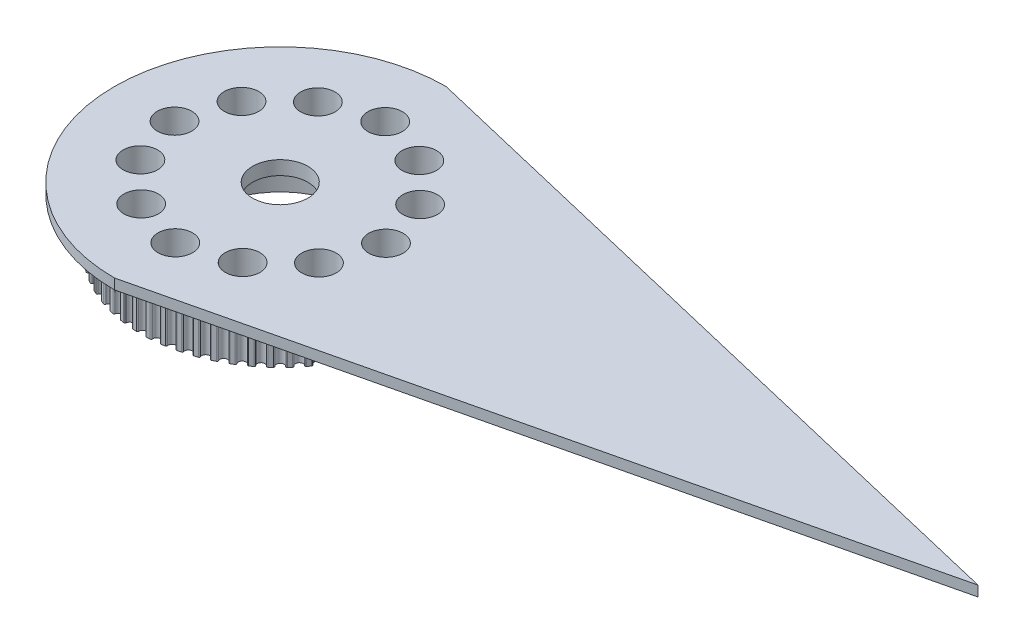
from build123d import *

# Parameters (mm, degrees)
BOSS_EXTRUDE1_DEPTH = 1.5
SKETCH2_R           = 11
BOSS_EXTRUDE3_DEPTH = 7.5
SKETCH3_R           = 6
SKETCH3_R_2         = 4
BOSS_EXTRUDE4_DEPTH = 0.5
SKETCH4_R           = 4
CUT_EXTRUDE1_DEPTH  = 105.082899652
SKETCH5_R           = 2.5
CUT_EXTRUDE2_DEPTH  = 105.201727433


with BuildPart() as part:
    # Sketch1 → Boss-Extrude1 (new body)
    with BuildSketch(Plane(origin=(0, 0, 0), x_dir=(1, 0, 0), z_dir=(0, 1, 0))):
        with BuildLine():
            Line((0, 24), (101, 0))
            Line((101, 0), (0, -24))
            ThreePointArc((0, -24), (-24, 0), (0, 24))
        make_face()
    extrude(amount=BOSS_EXTRUDE1_DEPTH)

    # Sketch2 → Boss-Extrude3 (add)
    with BuildSketch(Plane.XZ):
        with BuildLine():
            ThreePointArc((0, 19.37), (0.40140939, 19.54173051), (0.554407106, 19.950646841))
            ThreePointArc((0.554407106, 19.950646841), (0.597601495, 20.063061902), (0.709536651, 20.107485117))
            ThreePointArc((0.709536651, 20.107485117), (0.987241607, 20.095764579), (1.264758152, 20.080208834))
            ThreePointArc((1.264758152, 20.080208834), (1.371800073, 20.025027964), (1.403767866, 19.908920422))
            ThreePointArc((1.403767866, 19.908920422), (1.515948048, 19.486976737), (1.898592008, 19.276728156))
            ThreePointArc((1.898592008, 19.276728156), (2.314901036, 19.408286736), (2.507242836, 19.800237624))
            ThreePointArc((2.507242836, 19.800237624), (2.561247834, 19.907877585), (2.676998228, 19.941115327))
            ThreePointArc((2.676998228, 19.941115327), (2.952217146, 19.90223138), (3.226872643, 19.859549163))
            ThreePointArc((3.226872643, 19.859549163), (3.327990457, 19.794142061), (3.348423787, 19.675460217))
            ThreePointArc((3.348423787, 19.675460217), (3.418706077, 19.244552725), (3.778899537, 18.997810881))
            ThreePointArc((3.778899537, 18.997810881), (4.206098919, 19.087930551), (4.435932446, 19.459141295))
            ThreePointArc((4.435932446, 19.459141295), (4.500227957, 19.560969525), (4.61867885, 19.582701695))
            ThreePointArc((4.61867885, 19.582701695), (4.88876122, 19.517028814), (5.157910587, 19.447631177))
            ThreePointArc((5.157910587, 19.447631177), (5.252130474, 19.372627749), (5.260832557, 19.252514574))
            ThreePointArc((5.260832557, 19.252514574), (5.288540098, 18.81679315), (5.622814198, 18.535934303))
            ThreePointArc((5.622814198, 18.535934303), (6.05678977, 18.58374716), (6.321901602, 18.930642798))
            ThreePointArc((6.321901602, 18.930642798), (6.395868424, 19.025678635), (6.515879069, 19.035695941))
            ThreePointArc((6.515879069, 19.035695941), (6.77822385, 18.943866591), (7.039275031, 18.848421871))
            ThreePointArc((7.039275031, 18.848421871), (7.125689602, 18.764544442), (7.122576633, 18.644156691))
            ThreePointArc((7.122576633, 18.644156691), (7.107442587, 18.207817571), (7.412578085, 17.895546545))
            ThreePointArc((7.412578085, 17.895546545), (7.849150425, 17.900592125), (8.146987389, 18.219831862))
            ThreePointArc((8.146987389, 18.219831862), (8.229913182, 18.307160059), (8.35032781, 18.305366029))
            ThreePointArc((8.35032781, 18.305366029), (8.60240848, 18.188264578), (8.85284741, 18.067691959))
            ThreePointArc((8.85284741, 18.067691959), (8.930624445, 17.975748314), (8.915726402, 17.856245387))
            ThreePointArc((8.915726402, 17.856245387), (8.857896518, 17.423490756), (9.130954792, 17.08281489))
            ThreePointArc((9.130954792, 17.08281489), (9.565919471, 17.045044603), (9.893613234, 17.333553985))
            ThreePointArc((9.893613234, 17.333553985), (9.984699377, 17.412333524), (10.10435833, 17.398745436))
            ThreePointArc((10.10435833, 17.398745436), (10.343747213, 17.257499633), (10.581162028, 17.112960297))
            ThreePointArc((10.581162028, 17.112960297), (10.649552492, 17.013835903), (10.623012852, 16.896368679))
            ThreePointArc((10.623012852, 16.896368679), (10.523044063, 16.471366199), (10.761395414, 16.10556639))
            ThreePointArc((10.761395414, 16.10556639), (11.190563483, 16.025343983), (11.544958176, 16.280344508))
            ThreePointArc((11.544958176, 16.280344508), (11.643327459, 16.349816699), (11.761078356, 16.324565412))
            ThreePointArc((11.761078356, 16.324565412), (11.985470006, 16.160535533), (12.207574272, 15.993421473))
            ThreePointArc((12.207574272, 15.993421473), (12.265919528, 15.888070952), (12.227993882, 15.773770704))
            ThreePointArc((12.227993882, 15.773770704), (12.086848942, 15.360613382), (12.288197914, 14.973212482))
            ThreePointArc((12.288197914, 14.973212482), (12.707436251, 14.85131054), (13.085118859, 15.070346414))
            ThreePointArc((13.085118859, 15.070346414), (13.189823933, 15.129842201), (13.304532768, 15.0931709))
            ThreePointArc((13.304532768, 15.0931709), (13.511766172, 14.907936642), (13.716420902, 14.719857256))
            ThreePointArc((13.716420902, 14.719857256), (13.764159052, 14.609295192), (13.715212646, 14.499262694))
            ThreePointArc((13.715212646, 14.499262694), (13.534250858, 14.101929462), (13.696658352, 13.696658352))
            ThreePointArc((13.696658352, 13.696658352), (14.101929462, 13.534250858), (14.499262694, 13.715212646))
            ThreePointArc((14.499262694, 13.715212646), (14.609295192, 13.764159052), (14.719857256, 13.716420902))
            ThreePointArc((14.719857256, 13.716420902), (14.907936642, 13.511766172), (15.0931709, 13.304532768))
            ThreePointArc((15.0931709, 13.304532768), (15.129842201, 13.189823933), (15.070346414, 13.085118859))
            ThreePointArc((15.070346414, 13.085118859), (14.85131054, 12.707436251), (14.973212482, 12.288197914))
            ThreePointArc((14.973212482, 12.288197914), (15.360613382, 12.086848942), (15.773770704, 12.227993882))
            ThreePointArc((15.773770704, 12.227993882), (15.888070952, 12.265919528), (15.993421473, 12.207574272))
            ThreePointArc((15.993421473, 12.207574272), (16.160535533, 11.985470006), (16.324565412, 11.761078356))
            ThreePointArc((16.324565412, 11.761078356), (16.349816699, 11.643327459), (16.280344508, 11.544958176))
            ThreePointArc((16.280344508, 11.544958176), (16.025343983, 11.190563483), (16.10556639, 10.761395414))
            ThreePointArc((16.10556639, 10.761395414), (16.471366199, 10.523044063), (16.896368679, 10.623012852))
            ThreePointArc((16.896368679, 10.623012852), (17.013835903, 10.649552492), (17.112960297, 10.581162028))
            ThreePointArc((17.112960297, 10.581162028), (17.257499633, 10.343747213), (17.398745436, 10.10435833))
            ThreePointArc((17.398745436, 10.10435833), (17.412333524, 9.984699377), (17.333553985, 9.893613234))
            ThreePointArc((17.333553985, 9.893613234), (17.045044603, 9.565919471), (17.08281489, 9.130954792))
            ThreePointArc((17.08281489, 9.130954792), (17.423490756, 8.857896518), (17.856245387, 8.915726402))
            ThreePointArc((17.856245387, 8.915726402), (17.975748314, 8.930624445), (18.067691959, 8.85284741))
            ThreePointArc((18.067691959, 8.85284741), (18.188264578, 8.60240848), (18.305366029, 8.35032781))
            ThreePointArc((18.305366029, 8.35032781), (18.307160059, 8.229913182), (18.219831862, 8.146987389))
            ThreePointArc((18.219831862, 8.146987389), (17.900592125, 7.849150425), (17.895546545, 7.412578085))
            ThreePointArc((17.895546545, 7.412578085), (18.207817571, 7.107442587), (18.644156691, 7.122576633))
            ThreePointArc((18.644156691, 7.122576633), (18.764544442, 7.125689602), (18.848421871, 7.039275031))
            ThreePointArc((18.848421871, 7.039275031), (18.943866591, 6.77822385), (19.035695941, 6.515879069))
            ThreePointArc((19.035695941, 6.515879069), (19.025678635, 6.395868424), (18.930642798, 6.321901602))
            ThreePointArc((18.930642798, 6.321901602), (18.58374716, 6.05678977), (18.535934303, 5.622814198))
            ThreePointArc((18.535934303, 5.622814198), (18.81679315, 5.288540098), (19.252514574, 5.260832557))
            ThreePointArc((19.252514574, 5.260832557), (19.372627749, 5.252130474), (19.447631177, 5.157910587))
            ThreePointArc((19.447631177, 5.157910587), (19.517028814, 4.88876122), (19.582701695, 4.61867885))
            ThreePointArc((19.582701695, 4.61867885), (19.560969525, 4.500227957), (19.459141295, 4.435932446))
            ThreePointArc((19.459141295, 4.435932446), (19.087930551, 4.206098919), (18.997810881, 3.778899537))
            ThreePointArc((18.997810881, 3.778899537), (19.244552725, 3.418706077), (19.675460217, 3.348423787))
            ThreePointArc((19.675460217, 3.348423787), (19.794142061, 3.327990457), (19.859549163, 3.226872643))
            ThreePointArc((19.859549163, 3.226872643), (19.90223138, 2.952217146), (19.941115327, 2.676998228))
            ThreePointArc((19.941115327, 2.676998228), (19.907877585, 2.561247834), (19.800237624, 2.507242836))
            ThreePointArc((19.800237624, 2.507242836), (19.408286736, 2.314901036), (19.276728156, 1.898592008))
            ThreePointArc((19.276728156, 1.898592008), (19.486976737, 1.515948048), (19.908920422, 1.403767866))
            ThreePointArc((19.908920422, 1.403767866), (20.025027964, 1.371800073), (20.080208834, 1.264758152))
            ThreePointArc((20.080208834, 1.264758152), (20.095764579, 0.987241607), (20.107485117, 0.709536651))
            ThreePointArc((20.107485117, 0.709536651), (20.063061902, 0.597601495), (19.950646841, 0.554407106))
            ThreePointArc((19.950646841, 0.554407106), (19.54173051, 0.40140939), (19.37, 0))
            ThreePointArc((19.37, 0), (19.54173051, -0.40140939), (19.950646841, -0.554407106))
            ThreePointArc((19.950646841, -0.554407106), (20.063061902, -0.597601495), (20.107485117, -0.709536651))
            ThreePointArc((20.107485117, -0.709536651), (20.095764579, -0.987241607), (20.080208834, -1.264758152))
            ThreePointArc((20.080208834, -1.264758152), (20.025027964, -1.371800073), (19.908920422, -1.403767866))
            ThreePointArc((19.908920422, -1.403767866), (19.486976737, -1.515948048), (19.276728156, -1.898592008))
            ThreePointArc((19.276728156, -1.898592008), (19.408286736, -2.314901036), (19.800237624, -2.507242836))
            ThreePointArc((19.800237624, -2.507242836), (19.907877585, -2.561247834), (19.941115327, -2.676998228))
            ThreePointArc((19.941115327, -2.676998228), (19.90223138, -2.952217146), (19.859549163, -3.226872643))
            ThreePointArc((19.859549163, -3.226872643), (19.794142061, -3.327990457), (19.675460217, -3.348423787))
            ThreePointArc((19.675460217, -3.348423787), (19.244552725, -3.418706077), (18.997810881, -3.778899537))
            ThreePointArc((18.997810881, -3.778899537), (19.087930551, -4.206098919), (19.459141295, -4.435932446))
            ThreePointArc((19.459141295, -4.435932446), (19.560969525, -4.500227957), (19.582701695, -4.61867885))
            ThreePointArc((19.582701695, -4.61867885), (19.517028814, -4.88876122), (19.447631177, -5.157910587))
            ThreePointArc((19.447631177, -5.157910587), (19.372627749, -5.252130474), (19.252514574, -5.260832557))
            ThreePointArc((19.252514574, -5.260832557), (18.81679315, -5.288540098), (18.535934303, -5.622814198))
            ThreePointArc((18.535934303, -5.622814198), (18.58374716, -6.05678977), (18.930642798, -6.321901602))
            ThreePointArc((18.930642798, -6.321901602), (19.025678635, -6.395868424), (19.035695941, -6.515879069))
            ThreePointArc((19.035695941, -6.515879069), (18.943866591, -6.77822385), (18.848421871, -7.039275031))
            ThreePointArc((18.848421871, -7.039275031), (18.764544442, -7.125689602), (18.644156691, -7.122576633))
            ThreePointArc((18.644156691, -7.122576633), (18.207817571, -7.107442587), (17.895546545, -7.412578085))
            ThreePointArc((17.895546545, -7.412578085), (17.900592125, -7.849150425), (18.219831862, -8.146987389))
            ThreePointArc((18.219831862, -8.146987389), (18.307160059, -8.229913182), (18.305366029, -8.35032781))
            ThreePointArc((18.305366029, -8.35032781), (18.188264578, -8.60240848), (18.067691959, -8.85284741))
            ThreePointArc((18.067691959, -8.85284741), (17.975748314, -8.930624445), (17.856245387, -8.915726402))
            ThreePointArc((17.856245387, -8.915726402), (17.423490756, -8.857896518), (17.08281489, -9.130954792))
            ThreePointArc((17.08281489, -9.130954792), (17.045044603, -9.565919471), (17.333553985, -9.893613234))
            ThreePointArc((17.333553985, -9.893613234), (17.412333524, -9.984699377), (17.398745436, -10.10435833))
            ThreePointArc((17.398745436, -10.10435833), (17.257499633, -10.343747213), (17.112960297, -10.581162028))
            ThreePointArc((17.112960297, -10.581162028), (17.013835903, -10.649552492), (16.896368679, -10.623012852))
            ThreePointArc((16.896368679, -10.623012852), (16.471366199, -10.523044063), (16.10556639, -10.761395414))
            ThreePointArc((16.10556639, -10.761395414), (16.025343983, -11.190563483), (16.280344508, -11.544958176))
            ThreePointArc((16.280344508, -11.544958176), (16.349816699, -11.643327459), (16.324565412, -11.761078356))
            ThreePointArc((16.324565412, -11.761078356), (16.160535533, -11.985470006), (15.993421473, -12.207574272))
            ThreePointArc((15.993421473, -12.207574272), (15.888070952, -12.265919528), (15.773770704, -12.227993882))
            ThreePointArc((15.773770704, -12.227993882), (15.360613382, -12.086848942), (14.973212482, -12.288197914))
            ThreePointArc((14.973212482, -12.288197914), (14.85131054, -12.707436251), (15.070346414, -13.085118859))
            ThreePointArc((15.070346414, -13.085118859), (15.129842201, -13.189823933), (15.0931709, -13.304532768))
            ThreePointArc((15.0931709, -13.304532768), (14.907936642, -13.511766172), (14.719857256, -13.716420902))
            ThreePointArc((14.719857256, -13.716420902), (14.609295192, -13.764159052), (14.499262694, -13.715212646))
            ThreePointArc((14.499262694, -13.715212646), (14.101929462, -13.534250858), (13.696658352, -13.696658352))
            ThreePointArc((13.696658352, -13.696658352), (13.534250858, -14.101929462), (13.715212646, -14.499262694))
            ThreePointArc((13.715212646, -14.499262694), (13.764159052, -14.609295192), (13.716420902, -14.719857256))
            ThreePointArc((13.716420902, -14.719857256), (13.511766172, -14.907936642), (13.304532768, -15.0931709))
            ThreePointArc((13.304532768, -15.0931709), (13.189823933, -15.129842201), (13.085118859, -15.070346414))
            ThreePointArc((13.085118859, -15.070346414), (12.707436251, -14.85131054), (12.288197914, -14.973212482))
            ThreePointArc((12.288197914, -14.973212482), (12.086848942, -15.360613382), (12.227993882, -15.773770704))
            ThreePointArc((12.227993882, -15.773770704), (12.265919528, -15.888070952), (12.207574272, -15.993421473))
            ThreePointArc((12.207574272, -15.993421473), (11.985470006, -16.160535533), (11.761078356, -16.324565412))
            ThreePointArc((11.761078356, -16.324565412), (11.643327459, -16.349816699), (11.544958176, -16.280344508))
            ThreePointArc((11.544958176, -16.280344508), (11.190563483, -16.025343983), (10.761395414, -16.10556639))
            ThreePointArc((10.761395414, -16.10556639), (10.523044063, -16.471366199), (10.623012852, -16.896368679))
            ThreePointArc((10.623012852, -16.896368679), (10.649552492, -17.013835903), (10.581162028, -17.112960297))
            ThreePointArc((10.581162028, -17.112960297), (10.343747213, -17.257499633), (10.10435833, -17.398745436))
            ThreePointArc((10.10435833, -17.398745436), (9.984699377, -17.412333524), (9.893613234, -17.333553985))
            ThreePointArc((9.893613234, -17.333553985), (9.565919471, -17.045044603), (9.130954792, -17.08281489))
            ThreePointArc((9.130954792, -17.08281489), (8.857896518, -17.423490756), (8.915726402, -17.856245387))
            ThreePointArc((8.915726402, -17.856245387), (8.930624445, -17.975748314), (8.85284741, -18.067691959))
            ThreePointArc((8.85284741, -18.067691959), (8.60240848, -18.188264578), (8.35032781, -18.305366029))
            ThreePointArc((8.35032781, -18.305366029), (8.229913182, -18.307160059), (8.146987389, -18.219831862))
            ThreePointArc((8.146987389, -18.219831862), (7.849150425, -17.900592125), (7.412578085, -17.895546545))
            ThreePointArc((7.412578085, -17.895546545), (7.107442587, -18.207817571), (7.122576633, -18.644156691))
            ThreePointArc((7.122576633, -18.644156691), (7.125689602, -18.764544442), (7.039275031, -18.848421871))
            ThreePointArc((7.039275031, -18.848421871), (6.77822385, -18.943866591), (6.515879069, -19.035695941))
            ThreePointArc((6.515879069, -19.035695941), (6.395868424, -19.025678635), (6.321901602, -18.930642798))
            ThreePointArc((6.321901602, -18.930642798), (6.05678977, -18.58374716), (5.622814198, -18.535934303))
            ThreePointArc((5.622814198, -18.535934303), (5.288540098, -18.81679315), (5.260832557, -19.252514574))
            ThreePointArc((5.260832557, -19.252514574), (5.252130474, -19.372627749), (5.157910587, -19.447631177))
            ThreePointArc((5.157910587, -19.447631177), (4.88876122, -19.517028814), (4.61867885, -19.582701695))
            ThreePointArc((4.61867885, -19.582701695), (4.500227957, -19.560969525), (4.435932446, -19.459141295))
            ThreePointArc((4.435932446, -19.459141295), (4.206098919, -19.087930551), (3.778899537, -18.997810881))
            ThreePointArc((3.778899537, -18.997810881), (3.418706077, -19.244552725), (3.348423787, -19.675460217))
            ThreePointArc((3.348423787, -19.675460217), (3.327990457, -19.794142061), (3.226872643, -19.859549163))
            ThreePointArc((3.226872643, -19.859549163), (2.952217146, -19.90223138), (2.676998228, -19.941115327))
            ThreePointArc((2.676998228, -19.941115327), (2.561247834, -19.907877585), (2.507242836, -19.800237624))
            ThreePointArc((2.507242836, -19.800237624), (2.314901036, -19.408286736), (1.898592008, -19.276728156))
            ThreePointArc((1.898592008, -19.276728156), (1.515948048, -19.486976737), (1.403767866, -19.908920422))
            ThreePointArc((1.403767866, -19.908920422), (1.371800073, -20.025027964), (1.264758152, -20.080208834))
            ThreePointArc((1.264758152, -20.080208834), (0.987241607, -20.095764579), (0.709536651, -20.107485117))
            ThreePointArc((0.709536651, -20.107485117), (0.597601495, -20.063061902), (0.554407106, -19.950646841))
            ThreePointArc((0.554407106, -19.950646841), (0.40140939, -19.54173051), (0, -19.37))
            ThreePointArc((0, -19.37), (-0.40140939, -19.54173051), (-0.554407106, -19.950646841))
            ThreePointArc((-0.554407106, -19.950646841), (-0.597601495, -20.063061902), (-0.709536651, -20.107485117))
            ThreePointArc((-0.709536651, -20.107485117), (-0.987241607, -20.095764579), (-1.264758152, -20.080208834))
            ThreePointArc((-1.264758152, -20.080208834), (-1.371800073, -20.025027964), (-1.403767866, -19.908920422))
            ThreePointArc((-1.403767866, -19.908920422), (-1.515948048, -19.486976737), (-1.898592008, -19.276728156))
            ThreePointArc((-1.898592008, -19.276728156), (-2.314901036, -19.408286736), (-2.507242836, -19.800237624))
            ThreePointArc((-2.507242836, -19.800237624), (-2.561247834, -19.907877585), (-2.676998228, -19.941115327))
            ThreePointArc((-2.676998228, -19.941115327), (-2.952217146, -19.90223138), (-3.226872643, -19.859549163))
            ThreePointArc((-3.226872643, -19.859549163), (-3.327990457, -19.794142061), (-3.348423787, -19.675460217))
            ThreePointArc((-3.348423787, -19.675460217), (-3.418706077, -19.244552725), (-3.778899537, -18.997810881))
            ThreePointArc((-3.778899537, -18.997810881), (-4.206098919, -19.087930551), (-4.435932446, -19.459141295))
            ThreePointArc((-4.435932446, -19.459141295), (-4.500227957, -19.560969525), (-4.61867885, -19.582701695))
            ThreePointArc((-4.61867885, -19.582701695), (-4.88876122, -19.517028814), (-5.157910587, -19.447631177))
            ThreePointArc((-5.157910587, -19.447631177), (-5.252130474, -19.372627749), (-5.260832557, -19.252514574))
            ThreePointArc((-5.260832557, -19.252514574), (-5.288540098, -18.81679315), (-5.622814198, -18.535934303))
            ThreePointArc((-5.622814198, -18.535934303), (-6.05678977, -18.58374716), (-6.321901602, -18.930642798))
            ThreePointArc((-6.321901602, -18.930642798), (-6.395868424, -19.025678635), (-6.515879069, -19.035695941))
            ThreePointArc((-6.515879069, -19.035695941), (-6.77822385, -18.943866591), (-7.039275031, -18.848421871))
            ThreePointArc((-7.039275031, -18.848421871), (-7.125689602, -18.764544442), (-7.122576633, -18.644156691))
            ThreePointArc((-7.122576633, -18.644156691), (-7.107442587, -18.207817571), (-7.412578085, -17.895546545))
            ThreePointArc((-7.412578085, -17.895546545), (-7.849150425, -17.900592125), (-8.146987389, -18.219831862))
            ThreePointArc((-8.146987389, -18.219831862), (-8.229913182, -18.307160059), (-8.35032781, -18.305366029))
            ThreePointArc((-8.35032781, -18.305366029), (-8.60240848, -18.188264578), (-8.85284741, -18.067691959))
            ThreePointArc((-8.85284741, -18.067691959), (-8.930624445, -17.975748314), (-8.915726402, -17.856245387))
            ThreePointArc((-8.915726402, -17.856245387), (-8.857896518, -17.423490756), (-9.130954792, -17.08281489))
            ThreePointArc((-9.130954792, -17.08281489), (-9.565919471, -17.045044603), (-9.893613234, -17.333553985))
            ThreePointArc((-9.893613234, -17.333553985), (-9.984699377, -17.412333524), (-10.10435833, -17.398745436))
            ThreePointArc((-10.10435833, -17.398745436), (-10.343747213, -17.257499633), (-10.581162028, -17.112960297))
            ThreePointArc((-10.581162028, -17.112960297), (-10.649552492, -17.013835903), (-10.623012852, -16.896368679))
            ThreePointArc((-10.623012852, -16.896368679), (-10.523044063, -16.471366199), (-10.761395414, -16.10556639))
            ThreePointArc((-10.761395414, -16.10556639), (-11.190563483, -16.025343983), (-11.544958176, -16.280344508))
            ThreePointArc((-11.544958176, -16.280344508), (-11.643327459, -16.349816699), (-11.761078356, -16.324565412))
            ThreePointArc((-11.761078356, -16.324565412), (-11.985470006, -16.160535533), (-12.207574272, -15.993421473))
            ThreePointArc((-12.207574272, -15.993421473), (-12.265919528, -15.888070952), (-12.227993882, -15.773770704))
            ThreePointArc((-12.227993882, -15.773770704), (-12.086848942, -15.360613382), (-12.288197914, -14.973212482))
            ThreePointArc((-12.288197914, -14.973212482), (-12.707436251, -14.85131054), (-13.085118859, -15.070346414))
            ThreePointArc((-13.085118859, -15.070346414), (-13.189823933, -15.129842201), (-13.304532768, -15.0931709))
            ThreePointArc((-13.304532768, -15.0931709), (-13.511766172, -14.907936642), (-13.716420902, -14.719857256))
            ThreePointArc((-13.716420902, -14.719857256), (-13.764159052, -14.609295192), (-13.715212646, -14.499262694))
            ThreePointArc((-13.715212646, -14.499262694), (-13.534250858, -14.101929462), (-13.696658352, -13.696658352))
            ThreePointArc((-13.696658352, -13.696658352), (-14.101929462, -13.534250858), (-14.499262694, -13.715212646))
            ThreePointArc((-14.499262694, -13.715212646), (-14.609295192, -13.764159052), (-14.719857256, -13.716420902))
            ThreePointArc((-14.719857256, -13.716420902), (-14.907936642, -13.511766172), (-15.0931709, -13.304532768))
            ThreePointArc((-15.0931709, -13.304532768), (-15.129842201, -13.189823933), (-15.070346414, -13.085118859))
            ThreePointArc((-15.070346414, -13.085118859), (-14.85131054, -12.707436251), (-14.973212482, -12.288197914))
            ThreePointArc((-14.973212482, -12.288197914), (-15.360613382, -12.086848942), (-15.773770704, -12.227993882))
            ThreePointArc((-15.773770704, -12.227993882), (-15.888070952, -12.265919528), (-15.993421473, -12.207574272))
            ThreePointArc((-15.993421473, -12.207574272), (-16.160535533, -11.985470006), (-16.324565412, -11.761078356))
            ThreePointArc((-16.324565412, -11.761078356), (-16.349816699, -11.643327459), (-16.280344508, -11.544958176))
            ThreePointArc((-16.280344508, -11.544958176), (-16.025343983, -11.190563483), (-16.10556639, -10.761395414))
            ThreePointArc((-16.10556639, -10.761395414), (-16.471366199, -10.523044063), (-16.896368679, -10.623012852))
            ThreePointArc((-16.896368679, -10.623012852), (-17.013835903, -10.649552492), (-17.112960297, -10.581162028))
            ThreePointArc((-17.112960297, -10.581162028), (-17.257499633, -10.343747213), (-17.398745436, -10.10435833))
            ThreePointArc((-17.398745436, -10.10435833), (-17.412333524, -9.984699377), (-17.333553985, -9.893613234))
            ThreePointArc((-17.333553985, -9.893613234), (-17.045044603, -9.565919471), (-17.08281489, -9.130954792))
            ThreePointArc((-17.08281489, -9.130954792), (-17.423490756, -8.857896518), (-17.856245387, -8.915726402))
            ThreePointArc((-17.856245387, -8.915726402), (-17.975748314, -8.930624445), (-18.067691959, -8.85284741))
            ThreePointArc((-18.067691959, -8.85284741), (-18.188264578, -8.60240848), (-18.305366029, -8.35032781))
            ThreePointArc((-18.305366029, -8.35032781), (-18.307160059, -8.229913182), (-18.219831862, -8.146987389))
            ThreePointArc((-18.219831862, -8.146987389), (-17.900592125, -7.849150425), (-17.895546545, -7.412578085))
            ThreePointArc((-17.895546545, -7.412578085), (-18.207817571, -7.107442587), (-18.644156691, -7.122576633))
            ThreePointArc((-18.644156691, -7.122576633), (-18.764544442, -7.125689602), (-18.848421871, -7.039275031))
            ThreePointArc((-18.848421871, -7.039275031), (-18.943866591, -6.77822385), (-19.035695941, -6.515879069))
            ThreePointArc((-19.035695941, -6.515879069), (-19.025678635, -6.395868424), (-18.930642798, -6.321901602))
            ThreePointArc((-18.930642798, -6.321901602), (-18.58374716, -6.05678977), (-18.535934303, -5.622814198))
            ThreePointArc((-18.535934303, -5.622814198), (-18.81679315, -5.288540098), (-19.252514574, -5.260832557))
            ThreePointArc((-19.252514574, -5.260832557), (-19.372627749, -5.252130474), (-19.447631177, -5.157910587))
            ThreePointArc((-19.447631177, -5.157910587), (-19.517028814, -4.88876122), (-19.582701695, -4.61867885))
            ThreePointArc((-19.582701695, -4.61867885), (-19.560969525, -4.500227957), (-19.459141295, -4.435932446))
            ThreePointArc((-19.459141295, -4.435932446), (-19.087930551, -4.206098919), (-18.997810881, -3.778899537))
            ThreePointArc((-18.997810881, -3.778899537), (-19.244552725, -3.418706077), (-19.675460217, -3.348423787))
            ThreePointArc((-19.675460217, -3.348423787), (-19.794142061, -3.327990457), (-19.859549163, -3.226872643))
            ThreePointArc((-19.859549163, -3.226872643), (-19.90223138, -2.952217146), (-19.941115327, -2.676998228))
            ThreePointArc((-19.941115327, -2.676998228), (-19.907877585, -2.561247834), (-19.800237624, -2.507242836))
            ThreePointArc((-19.800237624, -2.507242836), (-19.408286736, -2.314901036), (-19.276728156, -1.898592008))
            ThreePointArc((-19.276728156, -1.898592008), (-19.486976737, -1.515948048), (-19.908920422, -1.403767866))
            ThreePointArc((-19.908920422, -1.403767866), (-20.025027964, -1.371800073), (-20.080208834, -1.264758152))
            ThreePointArc((-20.080208834, -1.264758152), (-20.095764579, -0.987241607), (-20.107485117, -0.709536651))
            ThreePointArc((-20.107485117, -0.709536651), (-20.063061902, -0.597601495), (-19.950646841, -0.554407106))
            ThreePointArc((-19.950646841, -0.554407106), (-19.54173051, -0.40140939), (-19.37, 0))
            ThreePointArc((-19.37, 0), (-19.54173051, 0.40140939), (-19.950646841, 0.554407106))
            ThreePointArc((-19.950646841, 0.554407106), (-20.063061902, 0.597601495), (-20.107485117, 0.709536651))
            ThreePointArc((-20.107485117, 0.709536651), (-20.095764579, 0.987241607), (-20.080208834, 1.264758152))
            ThreePointArc((-20.080208834, 1.264758152), (-20.025027964, 1.371800073), (-19.908920422, 1.403767866))
            ThreePointArc((-19.908920422, 1.403767866), (-19.486976737, 1.515948048), (-19.276728156, 1.898592008))
            ThreePointArc((-19.276728156, 1.898592008), (-19.408286736, 2.314901036), (-19.800237624, 2.507242836))
            ThreePointArc((-19.800237624, 2.507242836), (-19.907877585, 2.561247834), (-19.941115327, 2.676998228))
            ThreePointArc((-19.941115327, 2.676998228), (-19.90223138, 2.952217146), (-19.859549163, 3.226872643))
            ThreePointArc((-19.859549163, 3.226872643), (-19.794142061, 3.327990457), (-19.675460217, 3.348423787))
            ThreePointArc((-19.675460217, 3.348423787), (-19.244552725, 3.418706077), (-18.997810881, 3.778899537))
            ThreePointArc((-18.997810881, 3.778899537), (-19.087930551, 4.206098919), (-19.459141295, 4.435932446))
            ThreePointArc((-19.459141295, 4.435932446), (-19.560969525, 4.500227957), (-19.582701695, 4.61867885))
            ThreePointArc((-19.582701695, 4.61867885), (-19.517028814, 4.88876122), (-19.447631177, 5.157910587))
            ThreePointArc((-19.447631177, 5.157910587), (-19.372627749, 5.252130474), (-19.252514574, 5.260832557))
            ThreePointArc((-19.252514574, 5.260832557), (-18.81679315, 5.288540098), (-18.535934303, 5.622814198))
            ThreePointArc((-18.535934303, 5.622814198), (-18.58374716, 6.05678977), (-18.930642798, 6.321901602))
            ThreePointArc((-18.930642798, 6.321901602), (-19.025678635, 6.395868424), (-19.035695941, 6.515879069))
            ThreePointArc((-19.035695941, 6.515879069), (-18.943866591, 6.77822385), (-18.848421871, 7.039275031))
            ThreePointArc((-18.848421871, 7.039275031), (-18.764544442, 7.125689602), (-18.644156691, 7.122576633))
            ThreePointArc((-18.644156691, 7.122576633), (-18.207817571, 7.107442587), (-17.895546545, 7.412578085))
            ThreePointArc((-17.895546545, 7.412578085), (-17.900592125, 7.849150425), (-18.219831862, 8.146987389))
            ThreePointArc((-18.219831862, 8.146987389), (-18.307160059, 8.229913182), (-18.305366029, 8.35032781))
            ThreePointArc((-18.305366029, 8.35032781), (-18.188264578, 8.60240848), (-18.067691959, 8.85284741))
            ThreePointArc((-18.067691959, 8.85284741), (-17.975748314, 8.930624445), (-17.856245387, 8.915726402))
            ThreePointArc((-17.856245387, 8.915726402), (-17.423490756, 8.857896518), (-17.08281489, 9.130954792))
            ThreePointArc((-17.08281489, 9.130954792), (-17.045044603, 9.565919471), (-17.333553985, 9.893613234))
            ThreePointArc((-17.333553985, 9.893613234), (-17.412333524, 9.984699377), (-17.398745436, 10.10435833))
            ThreePointArc((-17.398745436, 10.10435833), (-17.257499633, 10.343747213), (-17.112960297, 10.581162028))
            ThreePointArc((-17.112960297, 10.581162028), (-17.013835903, 10.649552492), (-16.896368679, 10.623012852))
            ThreePointArc((-16.896368679, 10.623012852), (-16.471366199, 10.523044063), (-16.10556639, 10.761395414))
            ThreePointArc((-16.10556639, 10.761395414), (-16.025343983, 11.190563483), (-16.280344508, 11.544958176))
            ThreePointArc((-16.280344508, 11.544958176), (-16.349816699, 11.643327459), (-16.324565412, 11.761078356))
            ThreePointArc((-16.324565412, 11.761078356), (-16.160535533, 11.985470006), (-15.993421473, 12.207574272))
            ThreePointArc((-15.993421473, 12.207574272), (-15.888070952, 12.265919528), (-15.773770704, 12.227993882))
            ThreePointArc((-15.773770704, 12.227993882), (-15.360613382, 12.086848942), (-14.973212482, 12.288197914))
            ThreePointArc((-14.973212482, 12.288197914), (-14.85131054, 12.707436251), (-15.070346414, 13.085118859))
            ThreePointArc((-15.070346414, 13.085118859), (-15.129842201, 13.189823933), (-15.0931709, 13.304532768))
            ThreePointArc((-15.0931709, 13.304532768), (-14.907936642, 13.511766172), (-14.719857256, 13.716420902))
            ThreePointArc((-14.719857256, 13.716420902), (-14.609295192, 13.764159052), (-14.499262694, 13.715212646))
            ThreePointArc((-14.499262694, 13.715212646), (-14.101929462, 13.534250858), (-13.696658352, 13.696658352))
            ThreePointArc((-13.696658352, 13.696658352), (-13.534250858, 14.101929462), (-13.715212646, 14.499262694))
            ThreePointArc((-13.715212646, 14.499262694), (-13.764159052, 14.609295192), (-13.716420902, 14.719857256))
            ThreePointArc((-13.716420902, 14.719857256), (-13.511766172, 14.907936642), (-13.304532768, 15.0931709))
            ThreePointArc((-13.304532768, 15.0931709), (-13.189823933, 15.129842201), (-13.085118859, 15.070346414))
            ThreePointArc((-13.085118859, 15.070346414), (-12.707436251, 14.85131054), (-12.288197914, 14.973212482))
            ThreePointArc((-12.288197914, 14.973212482), (-12.086848942, 15.360613382), (-12.227993882, 15.773770704))
            ThreePointArc((-12.227993882, 15.773770704), (-12.265919528, 15.888070952), (-12.207574272, 15.993421473))
            ThreePointArc((-12.207574272, 15.993421473), (-11.985470006, 16.160535533), (-11.761078356, 16.324565412))
            ThreePointArc((-11.761078356, 16.324565412), (-11.643327459, 16.349816699), (-11.544958176, 16.280344508))
            ThreePointArc((-11.544958176, 16.280344508), (-11.190563483, 16.025343983), (-10.761395414, 16.10556639))
            ThreePointArc((-10.761395414, 16.10556639), (-10.523044063, 16.471366199), (-10.623012852, 16.896368679))
            ThreePointArc((-10.623012852, 16.896368679), (-10.649552492, 17.013835903), (-10.581162028, 17.112960297))
            ThreePointArc((-10.581162028, 17.112960297), (-10.343747213, 17.257499633), (-10.10435833, 17.398745436))
            ThreePointArc((-10.10435833, 17.398745436), (-9.984699377, 17.412333524), (-9.893613234, 17.333553985))
            ThreePointArc((-9.893613234, 17.333553985), (-9.565919471, 17.045044603), (-9.130954792, 17.08281489))
            ThreePointArc((-9.130954792, 17.08281489), (-8.857896518, 17.423490756), (-8.915726402, 17.856245387))
            ThreePointArc((-8.915726402, 17.856245387), (-8.930624445, 17.975748314), (-8.85284741, 18.067691959))
            ThreePointArc((-8.85284741, 18.067691959), (-8.60240848, 18.188264578), (-8.35032781, 18.305366029))
            ThreePointArc((-8.35032781, 18.305366029), (-8.229913182, 18.307160059), (-8.146987389, 18.219831862))
            ThreePointArc((-8.146987389, 18.219831862), (-7.849150425, 17.900592125), (-7.412578085, 17.895546545))
            ThreePointArc((-7.412578085, 17.895546545), (-7.107442587, 18.207817571), (-7.122576633, 18.644156691))
            ThreePointArc((-7.122576633, 18.644156691), (-7.125689602, 18.764544442), (-7.039275031, 18.848421871))
            ThreePointArc((-7.039275031, 18.848421871), (-6.77822385, 18.943866591), (-6.515879069, 19.035695941))
            ThreePointArc((-6.515879069, 19.035695941), (-6.395868424, 19.025678635), (-6.321901602, 18.930642798))
            ThreePointArc((-6.321901602, 18.930642798), (-6.05678977, 18.58374716), (-5.622814198, 18.535934303))
            ThreePointArc((-5.622814198, 18.535934303), (-5.288540098, 18.81679315), (-5.260832557, 19.252514574))
            ThreePointArc((-5.260832557, 19.252514574), (-5.252130474, 19.372627749), (-5.157910587, 19.447631177))
            ThreePointArc((-5.157910587, 19.447631177), (-4.88876122, 19.517028814), (-4.61867885, 19.582701695))
            ThreePointArc((-4.61867885, 19.582701695), (-4.500227957, 19.560969525), (-4.435932446, 19.459141295))
            ThreePointArc((-4.435932446, 19.459141295), (-4.206098919, 19.087930551), (-3.778899537, 18.997810881))
            ThreePointArc((-3.778899537, 18.997810881), (-3.418706077, 19.244552725), (-3.348423787, 19.675460217))
            ThreePointArc((-3.348423787, 19.675460217), (-3.327990457, 19.794142061), (-3.226872643, 19.859549163))
            ThreePointArc((-3.226872643, 19.859549163), (-2.952217146, 19.90223138), (-2.676998228, 19.941115327))
            ThreePointArc((-2.676998228, 19.941115327), (-2.561247834, 19.907877585), (-2.507242836, 19.800237624))
            ThreePointArc((-2.507242836, 19.800237624), (-2.314901036, 19.408286736), (-1.898592008, 19.276728156))
            ThreePointArc((-1.898592008, 19.276728156), (-1.515948048, 19.486976737), (-1.403767866, 19.908920422))
            ThreePointArc((-1.403767866, 19.908920422), (-1.371800073, 20.025027964), (-1.264758152, 20.080208834))
            ThreePointArc((-1.264758152, 20.080208834), (-0.987241607, 20.095764579), (-0.709536651, 20.107485117))
            ThreePointArc((-0.709536651, 20.107485117), (-0.597601495, 20.063061902), (-0.554407106, 19.950646841))
            ThreePointArc((-0.554407106, 19.950646841), (-0.40140939, 19.54173051), (0, 19.37))
        make_face()
        Circle(SKETCH2_R, mode=Mode.SUBTRACT)
    extrude(amount=BOSS_EXTRUDE3_DEPTH)

    # Sketch3 → Boss-Extrude4 (add)
    with BuildSketch(Plane.XZ):
        Circle(SKETCH3_R)
        Circle(SKETCH3_R_2, mode=Mode.SUBTRACT)
    extrude(amount=BOSS_EXTRUDE4_DEPTH)

    # Sketch4 → Cut-Extrude1 (cut, through all)
    with BuildSketch(Plane(origin=(0, 0, 0), x_dir=(-1, 0, 0), z_dir=(0, -1, 0))):
        Circle(SKETCH4_R)
    extrude(amount=-CUT_EXTRUDE1_DEPTH, mode=Mode.SUBTRACT)

    # Sketch5 → Cut-Extrude2 (cut, through all)
    with BuildSketch(Plane.XZ.offset(7.5)):
        with Locations((-15.300350342, 0)):
            Circle(SKETCH5_R)
        with Locations((-12.924607124, 7.320757719)):
            Circle(SKETCH5_R)
        with Locations((-7.343041731, 12.787829462)):
            Circle(SKETCH5_R)
        with Locations((7.343041731, 12.787829462)):
            Circle(SKETCH5_R)
        with Locations((12.924607124, 7.320757719)):
            Circle(SKETCH5_R)
        with Locations((15.300350342, 0)):
            Circle(SKETCH5_R)
        with Locations((0, 15.192196093)):
            Circle(SKETCH5_R)
        with Locations((12.924607124, -7.320757719)):
            Circle(SKETCH5_R)
        with Locations((7.343041731, -12.787829462)):
            Circle(SKETCH5_R)
        with Locations((0, -15.192196093)):
            Circle(SKETCH5_R)
        with Locations((-7.343041731, -12.787829462)):
            Circle(SKETCH5_R)
        with Locations((-12.924607124, -7.320757719)):
            Circle(SKETCH5_R)
    extrude(amount=-CUT_EXTRUDE2_DEPTH, mode=Mode.SUBTRACT)


solid = part.part
